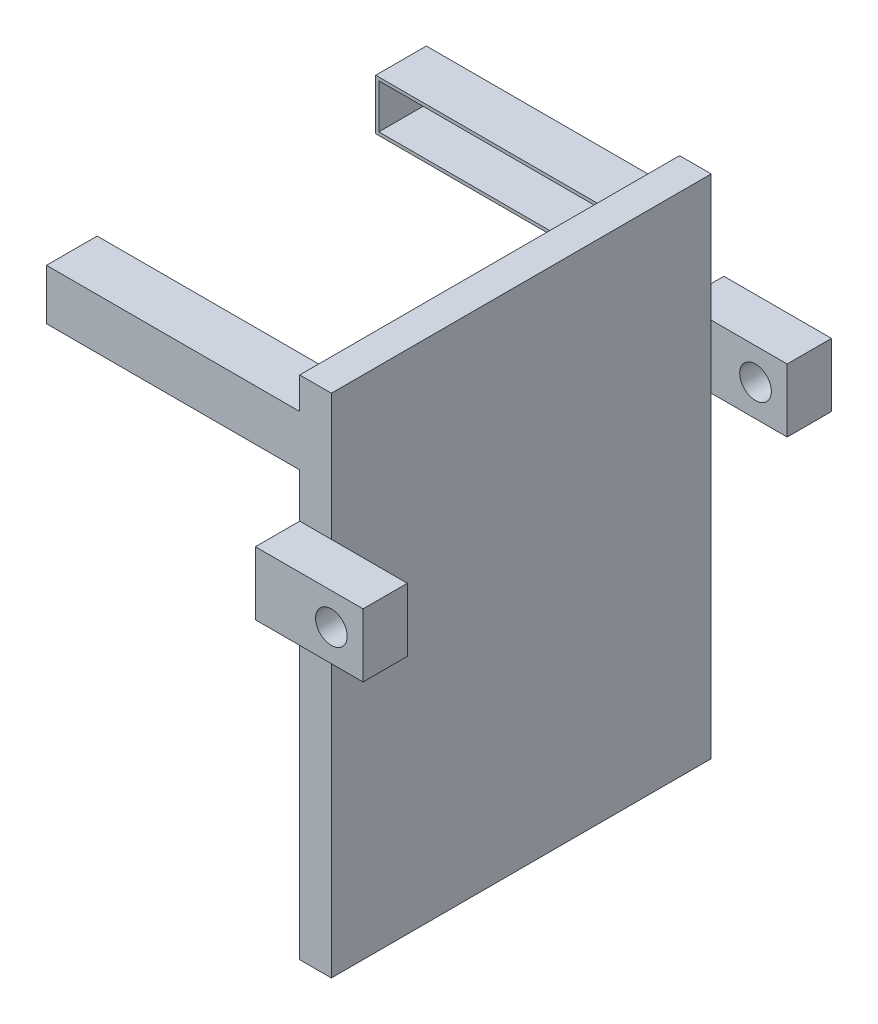
from build123d import *

# Parameters (mm, degrees)
SKETCH1_W           = 4
SKETCH1_H           = 0.8
BOSS_EXTRUDE1_DEPTH = 0.8
SKETCH3_W           = 0.5
SKETCH3_H           = 8
BOSS_EXTRUDE2_DEPTH = 6
SKETCH6_W           = 3.9
SKETCH6_H           = 0.7
CUT_EXTRUDE3_DEPTH  = 0.7
SKETCH9_W           = 1.7
SKETCH9_H           = 1
BOSS_EXTRUDE3_DEPTH = 0.7
SKETCH12_R          = 0.25
CUT_EXTRUDE5_DEPTH  = 11.119782606


with BuildPart() as part:
    # Sketch1 → Boss-Extrude1 (new body)
    with BuildSketch(Plane.XY):
        with Locations((-2, 0)):
            Rectangle(SKETCH1_W, SKETCH1_H)
    boss_extrude1 = extrude(amount=BOSS_EXTRUDE1_DEPTH)

    # Sketch3 → Boss-Extrude2 (add)
    with BuildSketch(Plane.XY.offset(0.8)):
        with Locations((0.25, -3.1)):
            Rectangle(SKETCH3_W, SKETCH3_H)
    extrude(amount=-BOSS_EXTRUDE2_DEPTH)

    # Sketch6 → Cut-Extrude3 (cut)
    with BuildSketch(Plane(origin=(0, 0, 0), x_dir=(-1, 0, 0), z_dir=(0, 0, -1))):
        with Locations((2, 0)):
            Rectangle(SKETCH6_W, SKETCH6_H)
    cut_extrude3 = extrude(amount=-CUT_EXTRUDE3_DEPTH, mode=Mode.SUBTRACT)

    # Sketch9 → Boss-Extrude3 (add)
    with BuildSketch(Plane.XY.offset(0.8)):
        with Locations((0.85, -1.6)):
            Rectangle(SKETCH9_W, SKETCH9_H)
    boss_extrude3 = extrude(amount=BOSS_EXTRUDE3_DEPTH)

    # Sketch12 → Cut-Extrude5 (cut, through all)
    with BuildSketch(Plane(origin=(0, 0, 0.8), x_dir=(-1, 0, 0), z_dir=(0, 0, -1))):
        with Locations((-1.2, -1.6)):
            Circle(SKETCH12_R)
    cut_extrude5 = extrude(amount=-CUT_EXTRUDE5_DEPTH, mode=Mode.SUBTRACT)

    # Mirror2: Boss-Extrude1, Boss-Extrude3, Cut-Extrude5 across plane
    add(boss_extrude1.mirror(Plane.XY.offset(-2.2)))
    add(boss_extrude3.mirror(Plane.XY.offset(-2.2)))
    add(cut_extrude5.mirror(Plane.XY.offset(-2.2)), mode=Mode.SUBTRACT)

    # Mirror3: Cut-Extrude3 across plane
    add(cut_extrude3.mirror(Plane.XY.offset(-2.2)), mode=Mode.SUBTRACT)


solid = part.part
